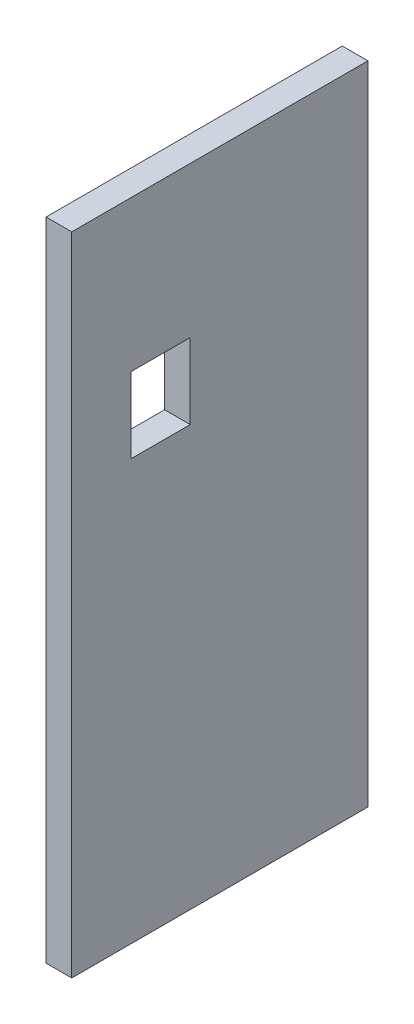
from build123d import *

# Parameters (mm, degrees)
SKETCH1_W           = 55
SKETCH1_H           = 120
BOSS_EXTRUDE1_DEPTH = 4.7625
SKETCH2_W           = 11
SKETCH2_H           = 14
CUT_EXTRUDE1_DEPTH  = 67.173494741


with BuildPart() as part:
    # Sketch1 → Boss-Extrude1 (new body)
    with BuildSketch(Plane(origin=(0, 0, 0), x_dir=(0, 0, -1), z_dir=(1, 0, 0))):
        Rectangle(SKETCH1_W, SKETCH1_H)
    extrude(amount=BOSS_EXTRUDE1_DEPTH)

    # Sketch2 → Cut-Extrude1 (cut, through all)
    with BuildSketch(Plane.ZY):
        with Locations((11, 25)):
            Rectangle(SKETCH2_W, SKETCH2_H)
    extrude(amount=-CUT_EXTRUDE1_DEPTH, mode=Mode.SUBTRACT)


solid = part.part
